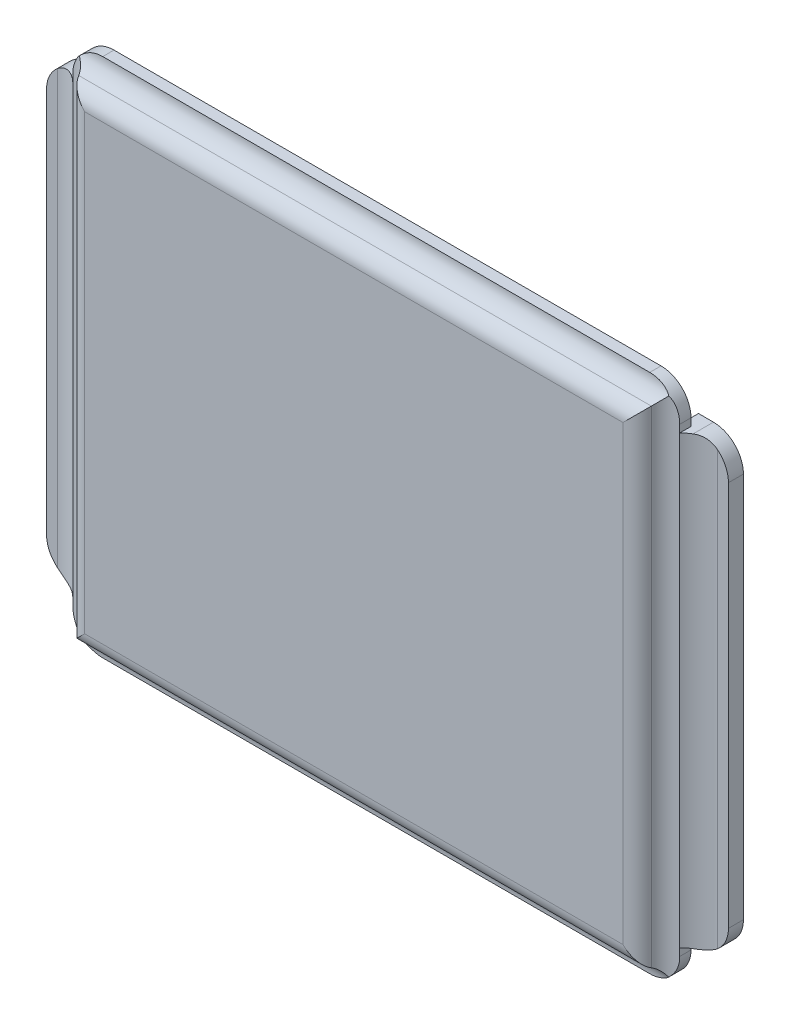
from build123d import *

# Parameters (mm, degrees)
SKETCH1_W             = 0.6
SKETCH1_H             = 5.95
BOSS_EXTRUDE1_DEPTH   = 0.2
BOSS_EXTRUDE1_2_DEPTH = 0.2
BOSS_EXTRUDE2_DEPTH   = 0.15
FILLET1_R             = 0.5
FILLET2_R             = 0.5
SKETCH3_W             = 7.6
SKETCH3_H             = 6.45
BOSS_EXTRUDE3_DEPTH   = 0.3
FILLET3_R             = 0.25
FILLET4_R             = 0.25
FILLET5_R             = 0.25
FILLET6_R             = 0.25
FILLET7_R             = 0.4


# Some blends are built 0.0001 mm under size
with BuildPart() as part:
    # Sketch1 → Boss-Extrude1 (new body)
    with BuildSketch(Plane.XY):
        with Locations((0.3, 2.975)):
            Rectangle(SKETCH1_W, SKETCH1_H)
    extrude(amount=BOSS_EXTRUDE1_DEPTH)



with BuildPart() as body_2:
    # Sketch1 → Boss-Extrude1 2 (new body)
    with BuildSketch(Plane.XY):
        with Locations((8.8, 2.975)):
            Rectangle(SKETCH1_W, SKETCH1_H)
    extrude(amount=BOSS_EXTRUDE1_2_DEPTH)


with BuildPart() as part_1:
    add(part.part)

    add(body_2.part)  # Boss-Extrude2 merges body 2
    # Sketch2 → Boss-Extrude2 (add)
    with BuildSketch(Plane.XY.offset(0.2)):
        Polygon((8.6, 6.45), (8.6, -0.5), (7.9, -0.5), (1.2, -0.5), (0.5, -0.5), (0.5, 6.45), (1.2, 6.45), (7.9, 6.45), align=None)
    extrude(amount=BOSS_EXTRUDE2_DEPTH)

    # Fillet1
    # the kernel refuses this fillet: 0.5 mm, written as the material it adds along each edge
    with BuildSketch(Plane(origin=(0.5, 0, 0.2), x_dir=(-1, 0, 0), z_dir=(0, 1, 0))) as fillet1_piece_1:
        with BuildLine():
            CenterArc((0.357071421, 0.5), FILLET1_R, 224.427004001, 45.572995999)
            Line((0, 0.15), (0, 0))
            Line((0, 0), (0.357071421, 0))
        make_face()
    extrude(amount=5.95)

    # Fillet2
    # the kernel refuses this fillet: 0.5 mm, written as the material it adds along each edge
    with BuildSketch(Plane(origin=(8.6, 5.95, 0.2), x_dir=(0, 0, 1), z_dir=(0, -1, 0))) as fillet2_piece_1:
        with BuildLine():
            CenterArc((0.5, -0.357071421), FILLET2_R, 134.427004001, 45.572995999)
            Line((0, -0.357071421), (0, 0))
            Line((0, 0), (0.15, 0))
        make_face()
    extrude(amount=5.95)

    # Sketch3 → Boss-Extrude3 (add)
    with BuildSketch(Plane.XY.offset(0.35)):
        with Locations((4.55, 2.975)):
            Rectangle(SKETCH3_W, SKETCH3_H)
    extrude(amount=BOSS_EXTRUDE3_DEPTH)

    # Fillet3
    fillet3_edges = [part_1.edges().sort_by_distance(p)[0] for p in [
        (0.75, 2.975, 0.35),
    ]]
    fillet(fillet3_edges, radius=FILLET3_R - 0.0001)  # a hair under: the kernel refuses the full size

    # Fillet4
    fillet4_edges = [part_1.edges().sort_by_distance(p)[0] for p in [
        (8.35, 2.975, 0.35),
    ]]
    fillet(fillet4_edges, radius=FILLET4_R - 0.0001)  # a hair under: the kernel refuses the full size

    # Fillet5
    fillet5_edges = [part_1.edges().sort_by_distance(p)[0] for p in [
        (4.55, 6.2, 0.35),
        (4.55, -0.25, 0.35),
    ]]
    fillet(fillet5_edges, radius=FILLET5_R - 0.0001)  # a hair under: the kernel refuses the full size

    # Fillet6
    fillet6_edges = [part_1.edges().sort_by_distance(p)[0] for p in [
        (8.35, 2.975, 0.65),
        (4.55, 6.2, 0.65),
        (4.55, -0.25, 0.65),
        (0.75, 2.975, 0.65),
    ]]
    fillet(fillet6_edges, radius=FILLET6_R)

    # Fillet7
    # the kernel refuses this fillet: 0.4 mm, written as the material it takes off along each edge
    with BuildSketch(Plane(origin=(9.1, 5.95, -1), x_dir=(-1, 0, 0), z_dir=(0, 0, 1)), Plane(origin=(0, 0, -1), x_dir=(1, 0, 0), z_dir=(0, 0, 1))) as fillet7_piece_1:
        with BuildLine():
            CenterArc((FILLET7_R, FILLET7_R), FILLET7_R, 180, 90)
            Line((0, FILLET7_R), (0, 0))
            Line((0, 0), (FILLET7_R, 0))
        make_face()
    extrude(amount=2.2, mode=Mode.SUBTRACT)
    with BuildSketch(Plane(origin=(8.6, 6.45, -0.8), x_dir=(0, -1, 0), z_dir=(0, 0, 1))) as fillet7_piece_2:
        with BuildLine():
            CenterArc((FILLET7_R, -FILLET7_R), FILLET7_R, 90, 90)
            Line((0, -FILLET7_R), (0, 0))
            Line((0, 0), (FILLET7_R, 0))
        make_face()
    extrude(amount=2.15, mode=Mode.SUBTRACT)
    with BuildSketch(Plane(origin=(8.6, -0.5, -0.8), x_dir=(0, 1, 0), z_dir=(0, 0, 1)), Plane(origin=(0.5, 6.45, -0.8), x_dir=(0, -1, 0), z_dir=(0, 0, 1)), Plane(origin=(0.5, -0.5, -0.8), x_dir=(1, 0, 0), z_dir=(0, 0, 1))) as fillet7_piece_3:
        with BuildLine():
            CenterArc((FILLET7_R, FILLET7_R), FILLET7_R, 180, 90)
            Line((0, FILLET7_R), (0, 0))
            Line((0, 0), (FILLET7_R, 0))
        make_face()
    extrude(amount=2.15, mode=Mode.SUBTRACT)
    with BuildSketch(Plane(origin=(9.1, 0, -1), x_dir=(-1, 0, 0), z_dir=(0, 0, 1)), Plane(origin=(0, 5.95, -1), x_dir=(1, 0, 0), z_dir=(0, 0, 1))) as fillet7_piece_4:
        with BuildLine():
            CenterArc((FILLET7_R, -FILLET7_R), FILLET7_R, 90, 90)
            Line((0, -FILLET7_R), (0, 0))
            Line((0, 0), (FILLET7_R, 0))
        make_face()
    extrude(amount=2.2, mode=Mode.SUBTRACT)


solid = part_1.part
